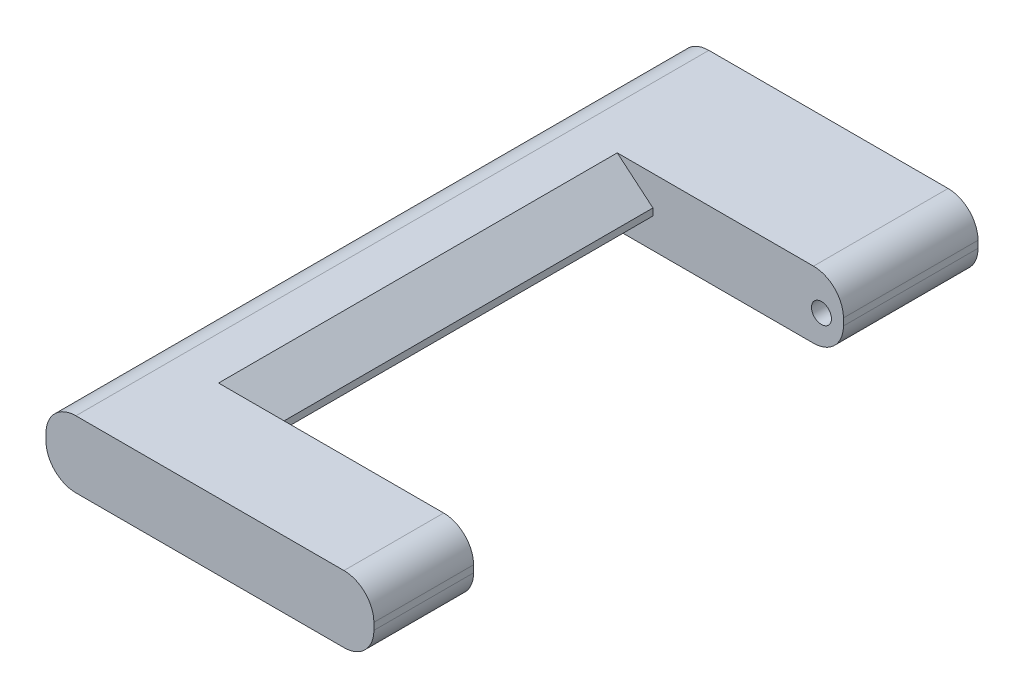
from build123d import *

# Parameters (mm, degrees)
SALIENTE_EXTRUIR1_DEPTH      = 19.999999999999996
SALIENTE_EXTRUIR2_DEPTH      = 100
SALIENTE_EXTRUIR3_DEPTH      = 6.9999999999999964
SALIENTE_EXTRUIR3_DEPTH_BACK = 19.999999999999943
SALIENTE_EXTRUIR4_DEPTH      = 2
REDONDEO1_R                  = 6
CHAFL_N1_SIZE                = 6
CHAFL_N1_SIZE2               = 7.150521555565286
CORTAR_EXTRUIR1_REACH        = 138.866
CROQUIS5_R                   = 2.000000000000176
REDONDEO2_R                  = 6


with BuildPart() as part:
    # Croquis1 → Saliente-Extruir1 (new body)
    with BuildSketch(Plane.XY):
        Polygon((15.29644660940674, 5.346446609406721), (15.29644660940674, -6.0535533905932795), (-50.49018216211465, -6.053553390593269), (-50.49018216211465, 5.346446609406709), align=None)
    extrude(amount=SALIENTE_EXTRUIR1_DEPTH)

    # Croquis2 → Saliente-Extruir2 (add)
    with BuildSketch(Plane(origin=(0, 0, 0), x_dir=(-1, 0, 0), z_dir=(0, 0, -1))):
        Polygon((50.49018216211465, 5.346446609406709), (50.49018216211465, -6.053553390593269), (28.718224366725977, -6.053553390593269), (28.718224366725977, 5.346446609406705), align=None)
    extrude(amount=SALIENTE_EXTRUIR2_DEPTH)

    # Croquis3 → Saliente-Extruir3 (add, two sides: drawn at the far end of the back side and taken through both)
    with BuildSketch(Plane(origin=(0, 0, -100), x_dir=(-1, 0, 0), z_dir=(0, 0, -1)).offset(-SALIENTE_EXTRUIR3_DEPTH_BACK)):
        Polygon((50.49018216211465, 5.346446609406709), (50.49018216211465, -6.053553390593269), (-9.509817837885349, -6.05355339059328), (-9.509817837885349, 5.346446609406698), align=None)
    extrude(amount=SALIENTE_EXTRUIR3_DEPTH + SALIENTE_EXTRUIR3_DEPTH_BACK)

    # Croquis4 → Saliente-Extruir4 (add)
    with BuildSketch(Plane(origin=(-9.2e-16, 5.346446609406718, 0), x_dir=(1, 1.7e-16, 0), z_dir=(-1.7e-16, 1, 0))):
        Polygon((9.50981783788535, 107), (-50.49018216211465, 107), (-50.49018216211465, -19.999999999999996), (15.296446609406742, -19.999999999999996), (15.296446609406742, 0), (-28.718224366725977, 0), (-28.718224366725977, 80.00000000000007), (9.50981783788535, 80.00000000000007), align=None)
    extrude(amount=SALIENTE_EXTRUIR4_DEPTH)

    # Redondeo1
    redondeo1_edges = [part.edges().sort_by_distance(p)[0] for p in [
        (-50.49018216211465, -6.053553390593269, -43.5),
        (-50.49018216211465, 7.346446609406709, -43.5),
    ]]
    fillet(redondeo1_edges, radius=REDONDEO1_R)

    # Chaflán1
    chafl_n1_edges = [part.edges().sort_by_distance(p)[0] for p in [
        (-28.718224366725977, 7.346446609406713, -40.000000000000036),
        (-28.718224366725977, -6.053553390593269, -40.00000000000003),
    ]]
    chafl_n1_side = [part.faces().sort_by_distance(p)[0] for p in [
        (-28.718224366725977, 0.6464466094067217, -40.00000000000003),
    ]]
    chamfer(chafl_n1_edges, length=CHAFL_N1_SIZE, length2=CHAFL_N1_SIZE2, reference=chafl_n1_side[0])

    # Croquis5 → Cortar-Extruir1 (cut, up to next)
    with BuildSketch(Plane(origin=(0, 0, -107), x_dir=(-1, 0, 0), z_dir=(0, 0, -1)), mode=Mode.PRIVATE) as cortar_extruir1_sk1:
        with Locations((-5.1000000000002625, -7.112e-14)):
            Circle(CROQUIS5_R)
    cortar_extruir1_tool1 = extrude(cortar_extruir1_sk1.sketch, amount=-CORTAR_EXTRUIR1_REACH, mode=Mode.PRIVATE) & part.part
    add(cortar_extruir1_tool1.solids().sort_by_distance((5.1, 0, -107))[0], mode=Mode.SUBTRACT)

    # Redondeo2
    redondeo2_edges = [part.edges().sort_by_distance(p)[0] for p in [
        (15.29644660940674, -6.0535533905932795, 9.999999999999998),
        (15.29644660940674, 7.346446609406721, 9.999999999999998),
        (9.509817837885349, -6.05355339059328, -93.50000000000003),
        (9.509817837885349, 7.34644660940672, -93.50000000000003),
    ]]
    fillet(redondeo2_edges, radius=REDONDEO2_R)


solid = part.part
